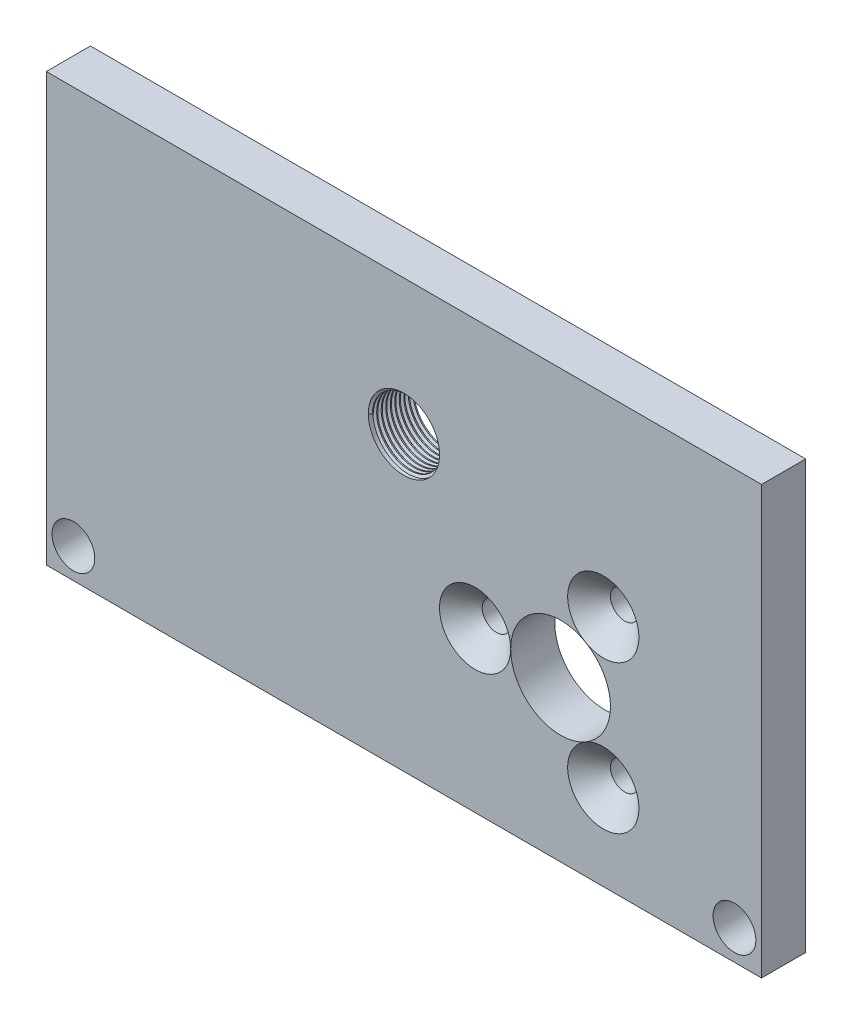
from build123d import *

# Parameters (mm, degrees)
ESBO_O1_W                = 50.2
ESBO_O1_H                = 30
ESBO_O1_R                = 2.5
ESBO_O1_R_2              = 3.5
ESBO_O1_R_3              = 1.5
ESBO_O1_R_4              = 1
RESSALTO_EXTRUS_O1_DEPTH = 3.1
CHANFRO1_SIZE            = 1.5
ROSCA2_PITCH             = 0.3175


with BuildPart() as part:
    # Esboço1 → Ressalto-extrusão1 (new body)
    with BuildSketch(Plane.XY):
        Rectangle(ESBO_O1_W, ESBO_O1_H)
        with Locations(Location((0, 5.5, 0), (0, 0, 180))):
            Circle(ESBO_O1_R, mode=Mode.SUBTRACT)
        with Locations(Location((10.994089321, -3.8, 0), (0, 0, 180))):
            Circle(ESBO_O1_R_2, mode=Mode.SUBTRACT)
        with Locations(Location((-23.2, -12.9, 0), (0, 0, 180))):
            Circle(ESBO_O1_R_3, mode=Mode.SUBTRACT)
        with Locations(Location((23.2, -12.9, 0), (0, 0, 180))):
            Circle(ESBO_O1_R_3, mode=Mode.SUBTRACT)
        with Locations(Location((13.994089321, 1.396152423, 0), (0, 0, 180))):
            Circle(ESBO_O1_R_4, mode=Mode.SUBTRACT)
        with Locations(Location((13.994089321, -8.996152423, 0), (0, 0, 180))):
            Circle(ESBO_O1_R_4, mode=Mode.SUBTRACT)
        with Locations(Location((4.994089321, -3.8, 0), (0, 0, 180))):
            Circle(ESBO_O1_R_4, mode=Mode.SUBTRACT)
    extrude(amount=RESSALTO_EXTRUS_O1_DEPTH)

    # Chanfro1
    chanfro1_edges = [part.edges().sort_by_distance(p)[0] for p in [
        (14.994089321, 1.396152423, 3.1),
        (14.994089321, -8.996152423, 3.1),
        (5.994089321, -3.8, 3.1),
    ]]
    chamfer(chanfro1_edges, length=CHANFRO1_SIZE - 0.0001)  # a hair under: the kernel refuses the full size

    # Rosca2: the profile of Perfil da rosca2 profile screwed along a right-hand helix of 9.448819 turns, 6 arcs to a turn; built about Z, then put on its axis
    rosca2_z = Axis((0, 0, 0), (0, 0, 1))
    rosca2_corners = [(2.5003, 0, -0.000173205), (2.5003, 0, 0.277985704), (2.328148085, 0, 0.17859375), (2.328148085, 0, 0.09921875)]
    with BuildLine(mode=Mode.PRIVATE) as rosca2_profile:
        Line(rosca2_corners[0], rosca2_corners[1])
        Line(rosca2_corners[1], rosca2_corners[2])
        Line(rosca2_corners[2], rosca2_corners[3])
        Line(rosca2_corners[3], rosca2_corners[0])
    rosca2_cap = Face(rosca2_profile.wire())
    rosca2_turn_angles = [0, 30, 60, 90, 120, 150, 180, 210, 240, 270, 300, 330, 360]
    rosca2_turn_weights = [1, 0.8660254037844387, 1, 0.8660254037844387, 1, 0.8660254037844387, 1, 0.8660254037844387, 1, 0.8660254037844387, 1, 0.8660254037844387, 1]
    rosca2_turn_rails = [Edge.make_bspline([Vector(p[0], p[1], 0).rotate(rosca2_z, rosca2_turn_angles[k]) / rosca2_turn_weights[k] + Vector(0, 0, p[2] + ROSCA2_PITCH * rosca2_turn_angles[k] / 360) for k in range(13)], [0, 0, 0, 1, 1, 2, 2, 3, 3, 4, 4, 5, 5, 6, 6, 6], 2, rosca2_turn_weights) for p in rosca2_corners]
    rosca2_turn_sides = [Face.make_surface_from_curves(rosca2_turn_rails[p[0]], rosca2_turn_rails[p[1]]) for p in [(0, 1), (1, 2), (2, 3), (3, 0)]]
    rosca2_last_angles = [3240, 3270, 3300, 3330, 3360, 3380.787401575, 3401.57480315]
    rosca2_last_weights = [1, 0.8660254037844387, 1, 0.8660254037844387, 1, 0.9349037361358654, 1]
    rosca2_last_rails = [Edge.make_bspline([Vector(p[0], p[1], 0).rotate(rosca2_z, rosca2_last_angles[k]) / rosca2_last_weights[k] + Vector(0, 0, p[2] + ROSCA2_PITCH * rosca2_last_angles[k] / 360) for k in range(7)], [0, 0, 0, 1, 1, 2, 2, 3, 3, 3], 2, rosca2_last_weights) for p in rosca2_corners]
    rosca2_last_sides = [Face.make_surface_from_curves(rosca2_last_rails[p[0]], rosca2_last_rails[p[1]]) for p in [(0, 1), (1, 2), (2, 3), (3, 0)]]
    rosca2 = Plane(origin=(0, 5.5, 3.1), x_dir=(-1, 0, 0), z_dir=(0, 0, -1)) * Solid(Shell([*[p.moved(Location((0, 0, ROSCA2_PITCH * i))) for i in range(9) for p in rosca2_turn_sides], *rosca2_last_sides, rosca2_cap, rosca2_cap.rotate(rosca2_z, 3401.57480315).moved(Location((0, 0, ROSCA2_PITCH * 3401.57480315 / 360)))]))
    add(rosca2)


solid = part.part
